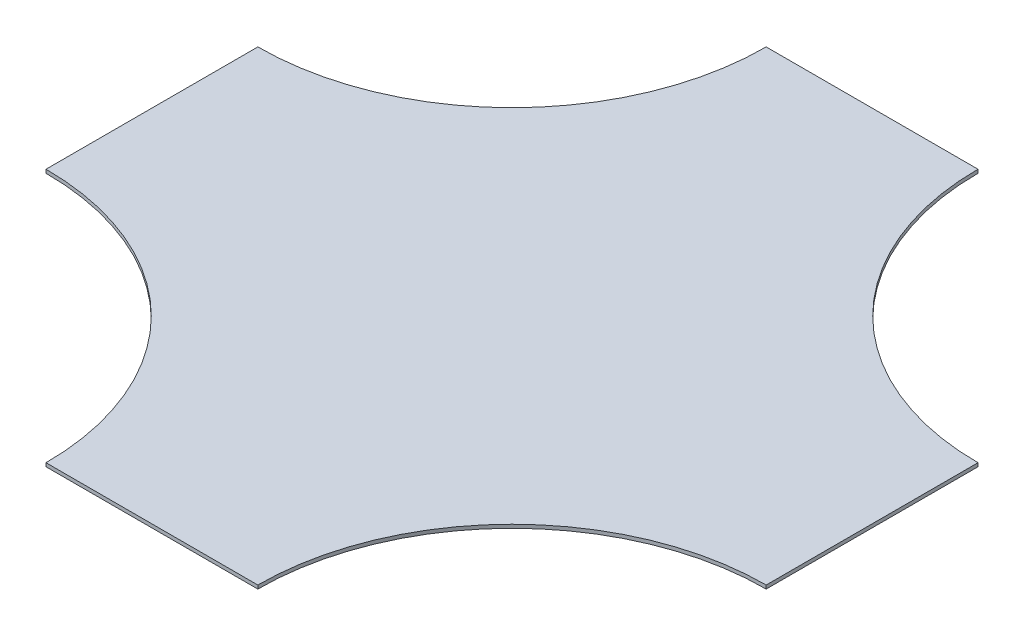
from build123d import *

# Parameters (mm, degrees)
BOSS_EXTRUDE1_DEPTH = 3.175


with BuildPart() as part:
    # Sketch1 → Boss-Extrude1 (new body)
    with BuildSketch(Plane(origin=(0, 0, 0), x_dir=(1, 0, 0), z_dir=(0, 1, 0))):
        with BuildLine():
            Line((-95.25, -323.85), (95.25, -323.85))
            ThreePointArc((95.25, -323.85), (162.205389821, -162.205389821), (323.85, -95.25))
            Line((323.85, -95.25), (323.85, 95.25))
            ThreePointArc((323.85, 95.25), (162.205389821, 162.205389821), (95.25, 323.85))
            Line((95.25, 323.85), (-95.25, 323.85))
            ThreePointArc((-95.25, 323.85), (-162.205389821, 162.205389821), (-323.85, 95.25))
            Line((-323.85, 95.25), (-323.85, -95.25))
            ThreePointArc((-323.85, -95.25), (-162.205389821, -162.205389821), (-95.25, -323.85))
        make_face()
    extrude(amount=BOSS_EXTRUDE1_DEPTH)


solid = part.part
